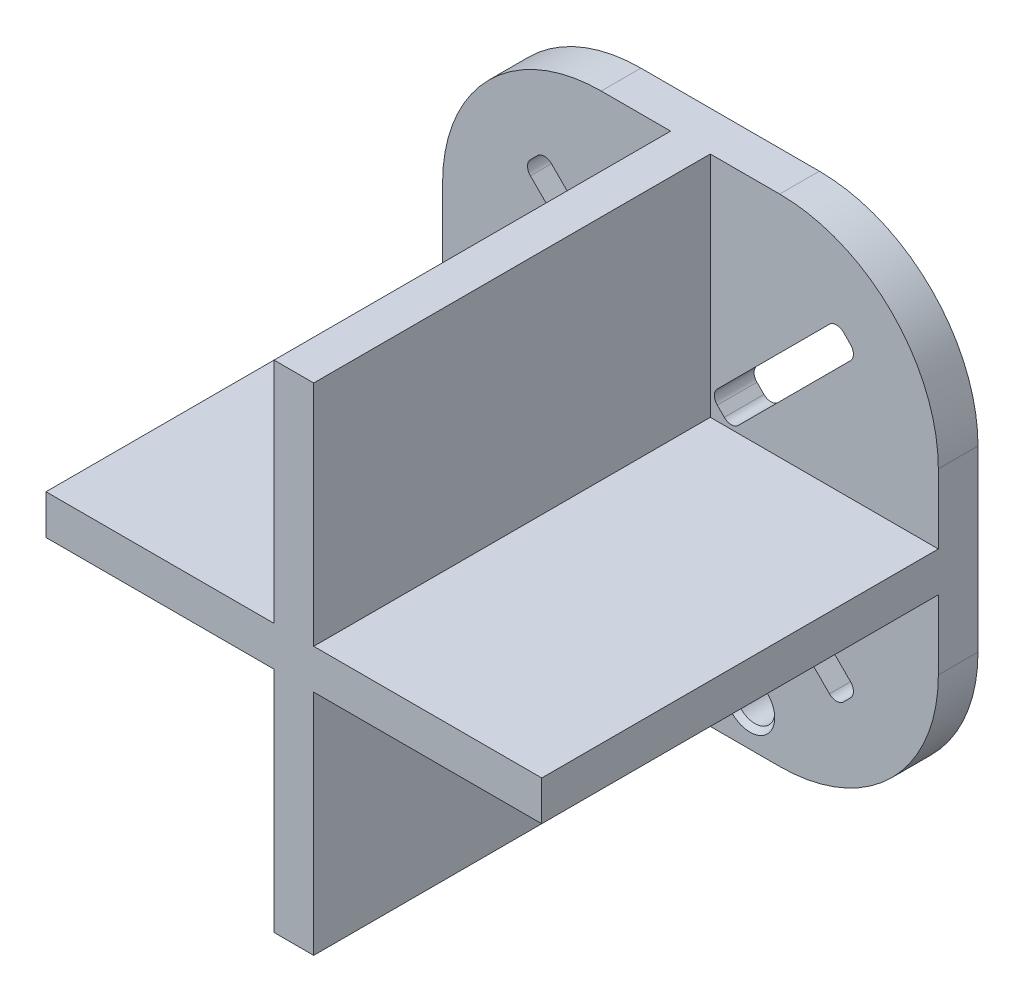
from build123d import *

# Parameters (mm, degrees)
SZKIC2_W                    = 25
SZKIC2_H                    = 25
DODANIE_WYCI_GNI_CIE1_DEPTH = 2
DODANIE_WYCI_GNI_CIE2_DEPTH = 20
ZAOKR_GLENIE1_R             = 8
WYTNIJ_WYCI_GNI_CIE1_DEPTH  = 20
ZAOKR_GLENIE2_R             = 0.5
WYTNIJ_WYCI_GNI_CIE2_DEPTH  = 20
WYTNIJ_WYCI_GNI_CIE3_DEPTH  = 20
WYTNIJ_WYCI_GNI_CIE4_DEPTH  = 20
ZAOKR_GLENIE3_R             = 0.5
SZKIC13_R                   = 1
WYTNIJ_WYCI_GNI_CIE5_DEPTH  = 20
SFAZOWANIE1_SIZE            = 0.25


with BuildPart() as part:
    # Szkic2 → Dodanie-wyciągnięcie1 (new body)
    with BuildSketch(Plane.XY):
        with Locations((12.5, -12.5)):
            Rectangle(SZKIC2_W, SZKIC2_H)
    extrude(amount=DODANIE_WYCI_GNI_CIE1_DEPTH)

    # Szkic3 → Dodanie-wyciągnięcie2 (add)
    with BuildSketch(Plane.XY.offset(2)):
        Polygon((11.5, 0), (13.5, 0), (13.5, -11.5), (25, -11.5), (25, -13.5), (13.5, -13.5), (13.5, -25), (11.5, -25), (11.5, -13.5), (0, -13.5), (0, -11.5), (11.5, -11.5), align=None)
    extrude(amount=DODANIE_WYCI_GNI_CIE2_DEPTH)

    # Zaokrąglenie1
    zaokr_glenie1_edges = [part.edges().sort_by_distance(p)[0] for p in [
        (25, -25, 1),
        (0, -25, 1),
        (25, 0, 1),
        (0, 0, 1),
    ]]
    fillet(zaokr_glenie1_edges, radius=ZAOKR_GLENIE1_R)

    # Szkic7 → Wytnij-wyciągnięcie1 (cut)
    with BuildSketch(Plane.XY.offset(2)):
        Polygon((10.439339828, -13.5), (11.5, -14.560660172), (5.136038969, -20.924621202), (4.075378798, -19.863961031), align=None)
    extrude(amount=-WYTNIJ_WYCI_GNI_CIE1_DEPTH, mode=Mode.SUBTRACT)

    # Zaokrąglenie2
    zaokr_glenie2_edges = [part.edges().sort_by_distance(p)[0] for p in [
        (5.136038969, -20.924621202, 1),
        (4.075378798, -19.863961031, 1),
        (11.5, -14.560660172, 1),
        (10.439339828, -13.5, 1),
    ]]
    fillet(zaokr_glenie2_edges, radius=ZAOKR_GLENIE2_R)

    # Szkic9 → Wytnij-wyciągnięcie2 (cut)
    with BuildSketch(Plane.XY.offset(2)):
        Polygon((11.5, -10.439339828), (10.439339828, -11.5), (4.075378798, -5.136038969), (5.136038969, -4.075378798), align=None)
    extrude(amount=-WYTNIJ_WYCI_GNI_CIE2_DEPTH, mode=Mode.SUBTRACT)

    # Szkic11 → Wytnij-wyciągnięcie3 (cut)
    with BuildSketch(Plane.XY.offset(2)):
        Polygon((13.5, -10.439339828), (14.560660172, -11.5), (20.924621202, -5.136038969), (19.863961031, -4.075378798), align=None)
    extrude(amount=-WYTNIJ_WYCI_GNI_CIE3_DEPTH, mode=Mode.SUBTRACT)

    # Szkic12 → Wytnij-wyciągnięcie4 (cut)
    with BuildSketch(Plane.XY.offset(2)):
        Polygon((14.560660172, -13.5), (13.5, -14.560660172), (19.863961031, -20.924621202), (20.924621202, -19.863961031), align=None)
    extrude(amount=-WYTNIJ_WYCI_GNI_CIE4_DEPTH, mode=Mode.SUBTRACT)

    # Zaokrąglenie3
    zaokr_glenie3_edges = [part.edges().sort_by_distance(p)[0] for p in [
        (4.075378798, -5.136038969, 1),
        (5.136038969, -4.075378798, 1),
        (11.5, -10.439339828, 1),
        (10.439339828, -11.5, 1),
        (19.863961031, -20.924621202, 1),
        (20.924621202, -19.863961031, 1),
        (20.924621202, -5.136038969, 1),
        (19.863961031, -4.075378798, 1),
        (14.560660172, -11.5, 1),
        (13.5, -10.439339828, 1),
        (13.5, -14.560660172, 1),
        (14.560660172, -13.5, 1),
    ]]
    fillet(zaokr_glenie3_edges, radius=ZAOKR_GLENIE3_R)

    # Szkic13 → Wytnij-wyciągnięcie5 (cut)
    with BuildSketch(Plane.XY.offset(2)):
        with Locations((9.5, -23)):
            Circle(SZKIC13_R)
        with Locations((15.5, -23)):
            Circle(SZKIC13_R)
    extrude(amount=-WYTNIJ_WYCI_GNI_CIE5_DEPTH, mode=Mode.SUBTRACT)

    # Sfazowanie1
    sfazowanie1_edges = [part.edges().sort_by_distance(p)[0] for p in [
        (14.5, -23, 2),
        (8.5, -23, 2),
    ]]
    chamfer(sfazowanie1_edges, length=SFAZOWANIE1_SIZE)


solid = part.part
